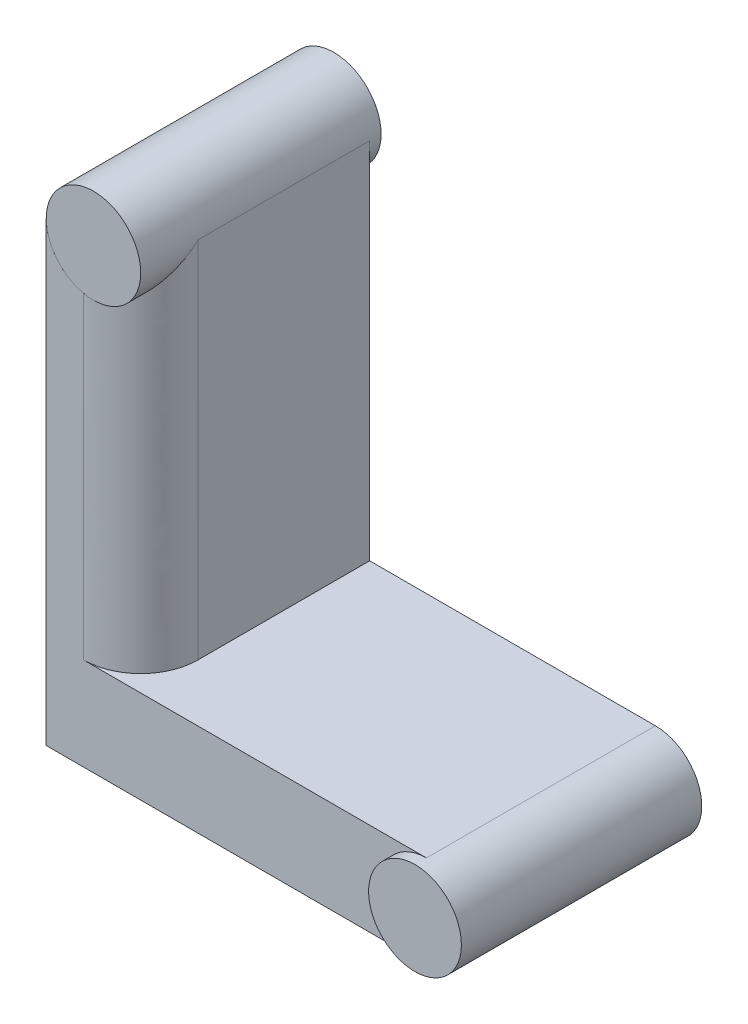
from build123d import *

# Parameters (mm, degrees)
BOSS_EXTRUDE1_DEPTH = 40
SKETCH2_R           = 8.25386472
BOSS_EXTRUDE2_DEPTH = 42
SKETCH3_R           = 8.105899881
BOSS_EXTRUDE3_DEPTH = 42
FILLET4_START       = -26.119010727
FILLET4_DEPTH       = 64.119010727


with BuildPart() as part:
    # Sketch1 → Boss-Extrude1 (new body)
    with BuildSketch(Plane.XY):
        with BuildLine():
            Line((0, 37.441537545), (0, -42.330810489))
            Line((0, -42.330810489), (66.429779499, -42.330810489))
            ThreePointArc((66.429779499, -42.330810489), (58.323879619, -34.224910608), (66.429779499, -26.119010727))
            Line((66.429779499, -26.119010727), (16.50772944, -26.119010727))
            Line((16.50772944, -26.119010727), (16.50772944, 37.441537545))
            ThreePointArc((16.50772944, 37.441537545), (8.25386472, 29.187672825), (0, 37.441537545))
        make_face()
    extrude(amount=BOSS_EXTRUDE1_DEPTH)

    # Sketch3 → Boss-Extrude3 (add)
    with BuildSketch(Plane.XY):
        with Locations(Location((66.429779499, -34.224910608, 0), (0, 0, 90))):
            Circle(SKETCH3_R)
    extrude(amount=BOSS_EXTRUDE3_DEPTH)

    # Fillet4: read off the stored shape, not the designer's step
    # Fillet4 outline → Fillet4 (cut)
    with BuildSketch(Plane(origin=(0, 0, 0), x_dir=(1, 0, 0), z_dir=(0, 1, 0)).offset(FILLET4_START)):
        with BuildLine():
            Line((16.50772944, -40), (16.50772944, -30))
            add(Edge.make_bspline(
                [(16.50772944, -30), (16.50772944, -40), (6.50772944, -40)],
                knots=[0, 0, 0, 1, 1, 1], degree=2, weights=[1, 0.707106781, 1]))
            Line((6.50772944, -40), (16.50772944, -40))
        make_face()
    extrude(amount=FILLET4_DEPTH, mode=Mode.SUBTRACT)


with BuildPart() as body_2:
    # Sketch2 → Boss-Extrude2 (new body)
    with BuildSketch(Plane.XY.offset(40)):
        with Locations((8.25386472, 37.441537545)):
            Circle(SKETCH2_R)
    extrude(amount=-BOSS_EXTRUDE2_DEPTH)


solid = Compound([part.part, body_2.part])
